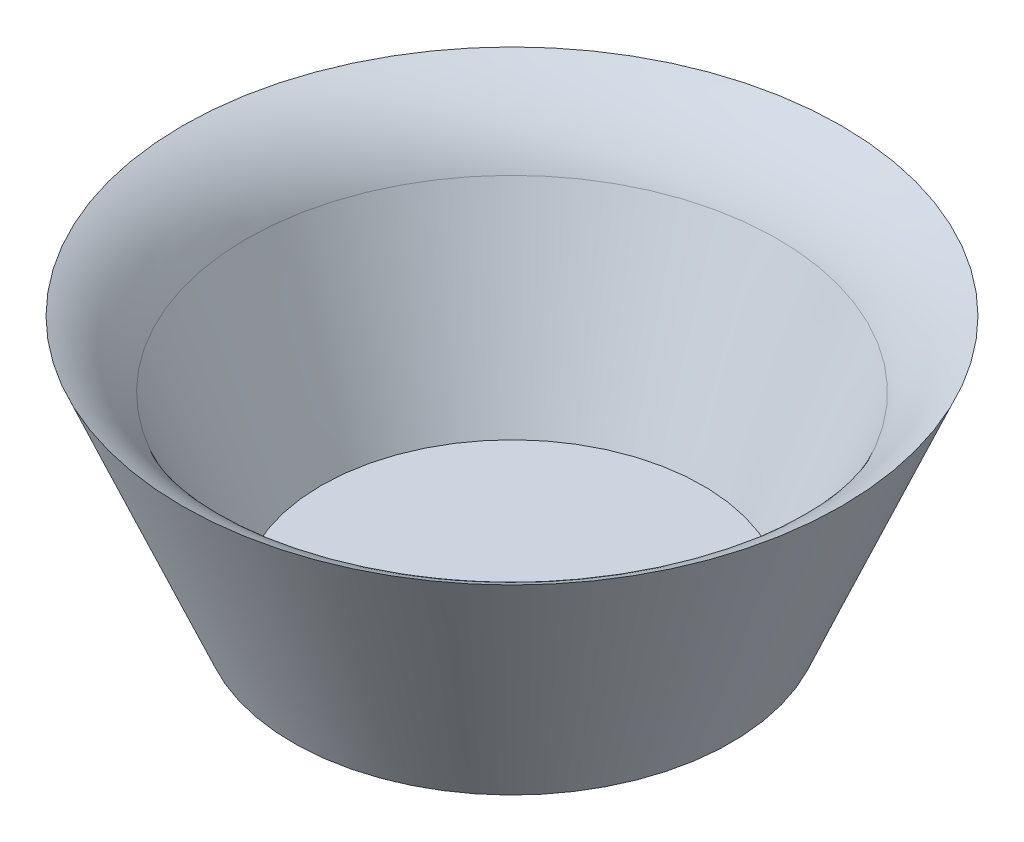
from build123d import *

# Parameters (mm, degrees)
FILLET2_R = 25


with BuildPart() as part:
    # Sketch1 → Revolve1 (revolve)
    with BuildSketch(Plane.XY):
        Polygon((0, 0), (0, -3.5), (-43, -3.5), (-64.648215627, 47.5), (-57.586873174, 47.5), (-37.424319404, 0), align=None)
    revolve(axis=Axis((0, -36.803347039, 0), (0, -1, 0)))

    # Fillet2
    # the kernel refuses this fillet: 25 mm, written as the material it takes off along each edge
    with BuildSketch(Plane(origin=(0, 47.5, 0), x_dir=(-1, 0, 0), z_dir=(0, 0, 1))) as fillet2_piece_1:
        with BuildLine():
            CenterArc((75.107344393, 22.706973058), FILLET2_R, 203, 42.26858443)
            Line((52.094723057, 12.938694845), (51.63447063, 12.743329281))
            Line((51.63447063, 12.743329281), (57.126620747, -0.195365564))
            Line((57.126620747, -0.195365564), (57.586873174, -0.5))
            ThreePointArc((57.586873174, -0.5), (61.1175444, -0.5), (64.439033051, -0.454139461))
            Line((64.439033051, -0.454139461), (64.648215627, 0))
        make_face()
    revolve(axis=Axis((0, 47.5, 0), (0, -1, 0)), mode=Mode.SUBTRACT)


solid = part.part
